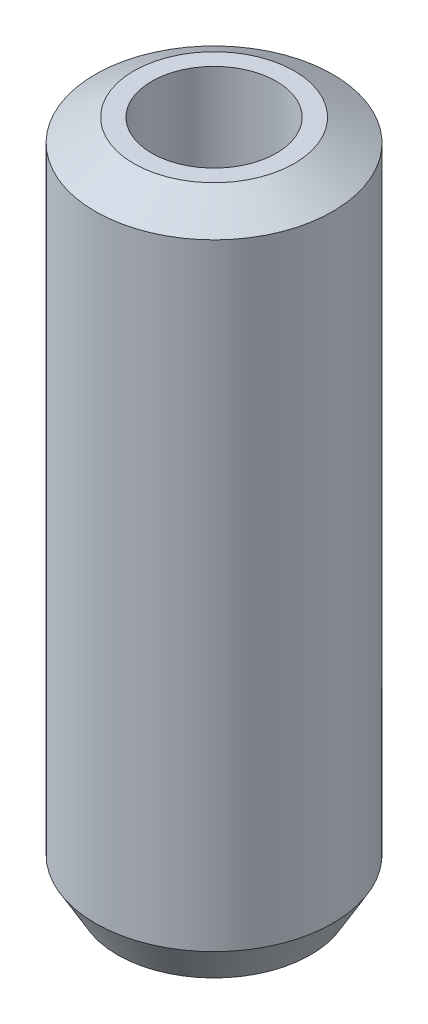
from build123d import *
from OCP.BRepFilletAPI import BRepFilletAPI_MakeChamfer

# Parameters (mm, degrees)
SKETCH1_R           = 5
BOSS_EXTRUDE1_DEPTH = 28.507115568
SKETCH2_R           = 2.623711844
CUT_EXTRUDE1_DEPTH  = 30.370999949
CHAMFER1_SIZE       = 0.93613151
CHAMFER1_SIZE2      = 1.621427338


with BuildPart() as part:
    # Sketch1 → Boss-Extrude1 (new body)
    with BuildSketch(Plane(origin=(0, 0, 0), x_dir=(1, 0, 0), z_dir=(0, 1, 0))):
        Circle(SKETCH1_R)
    extrude(amount=BOSS_EXTRUDE1_DEPTH)

    # Sketch2 → Cut-Extrude1 (cut, through all)
    with BuildSketch(Plane(origin=(0, 0, 0), x_dir=(1, 0, 0), z_dir=(0, 1, 0))):
        Circle(SKETCH2_R)
    extrude(amount=CUT_EXTRUDE1_DEPTH, mode=Mode.SUBTRACT)

    # Chamfer1: one chamfer whose edges measure the first distance from different faces: ONE call of the kernel's chamfer builder (chamfer() names one face for all edges)
    chamfer1_edges_1 = [part.edges().sort_by_distance(p)[0] for p in [
        (-5, 28.507115568, 0),
    ]]
    chamfer1_side_1 = [part.faces().sort_by_distance(p)[0] for p in [
        (-5, 14.253557784, 0),
    ]]
    chamfer1_edges_2 = [part.edges().sort_by_distance(p)[0] for p in [
        (-5, 0, 0),
    ]]
    chamfer1_side_2 = [part.faces().sort_by_distance(p)[0] for p in [
        (-4.858578644, 0, 0),
    ]]
    chamfer1 = BRepFilletAPI_MakeChamfer(part.part.solid().wrapped)
    for e in chamfer1_edges_1:
        chamfer1.Add(CHAMFER1_SIZE, CHAMFER1_SIZE2, e.wrapped, chamfer1_side_1[0].wrapped)  # the first distance lies on this face
    for e in chamfer1_edges_2:
        chamfer1.Add(CHAMFER1_SIZE, CHAMFER1_SIZE2, e.wrapped, chamfer1_side_2[0].wrapped)  # the first distance lies on this face
    add(Compound.cast(chamfer1.Shape()), mode=Mode.REPLACE)


solid = part.part
